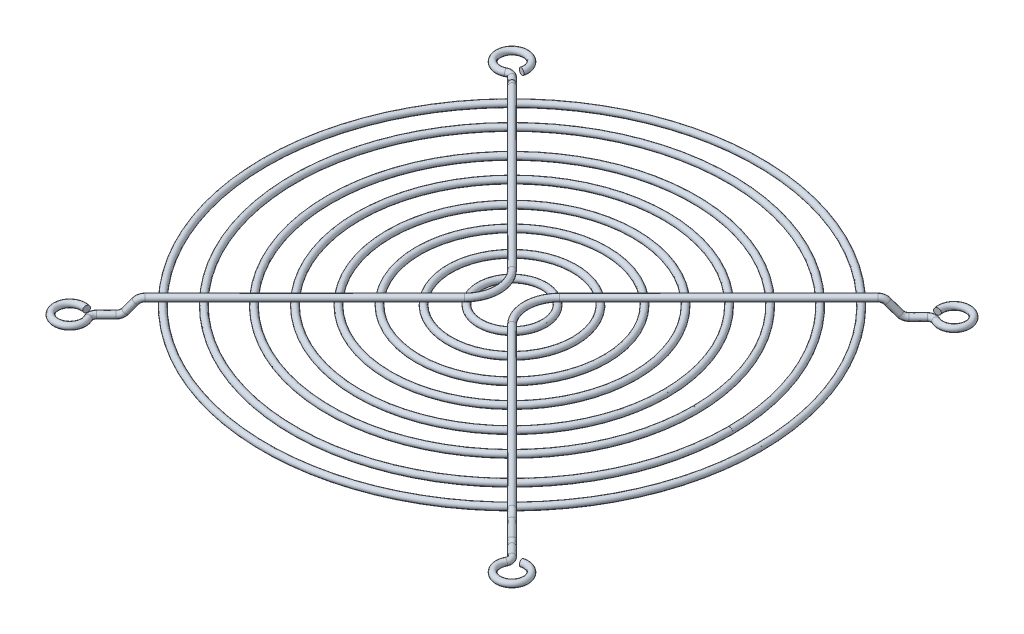
from build123d import *

# Parameters (mm, degrees)
BALAYAGE2_OUTLINE_R = 0.75
BALAYAGE2_ANGLE     = 359.984281
ESQUISSE4_R         = 0.75
ESQUISSE5_R         = 0.75
ESQUISSE7_R         = 0.75
ESQUISSE8_R         = 0.75
ESQUISSE11_R        = 0.75
ESQUISSE13_R        = 0.75
ESQUISSE19_R        = 0.75
ESQUISSE15_R        = 0.75
ESQUISSE20_R        = 0.75
ESQUISSE21_R        = 0.75


# Read off the part's stored shape, not the designer's step: Balayage2
with BuildPart() as part:
    # Balayage2 outline → Balayage2 (revolve)
    with BuildSketch(Plane.XY):
        with Locations((58.65, 0)):
            Circle(BALAYAGE2_OUTLINE_R)
        with Locations((51.75, 0)):
            Circle(BALAYAGE2_OUTLINE_R)
        with Locations((43.35, 0)):
            Circle(BALAYAGE2_OUTLINE_R)
        with Locations((36.45, 0)):
            Circle(BALAYAGE2_OUTLINE_R)
        with Locations((29.15, 0)):
            Circle(BALAYAGE2_OUTLINE_R)
        with Locations((22.25, 0)):
            Circle(BALAYAGE2_OUTLINE_R)
        with Locations((14.85, 0)):
            Circle(BALAYAGE2_OUTLINE_R)
        with Locations((7.65, 0)):
            Circle(BALAYAGE2_OUTLINE_R)
    revolve(axis=Axis((0, 0, 0), (0, 1, 0)), revolution_arc=BALAYAGE2_ANGLE)


with BuildPart() as body_2:
    # Balayage3: sweep along a path in Esquisse3
    with BuildLine(Plane(origin=(0, 1.5, 0), x_dir=(-1, 0, 0), z_dir=(0, 1, 0))) as balayage3_path:
        Line((-43, -43), (-5.656854249, -5.656854249))
        ThreePointArc((-5.656854249, -5.656854249), (-3.313708499, 0), (-5.656854249, 5.656854249))
        Line((-5.656854249, 5.656854249), (-43, 43))
    # Esquisse4 → Balayage3 (sweep)
    with BuildSketch(Plane(origin=(43, 0, -43), x_dir=(-0.7071067811865488, 0, -0.7071067811865462), z_dir=(0.7071067811865462, 0, -0.7071067811865488))):
        with Locations((0, 1.5)):
            Circle(ESQUISSE4_R)
    sweep(path=balayage3_path.line)

    # Balayage14: sweep along a path in Esquisse9
    with BuildLine(Plane(origin=(0, 0, 0), x_dir=(0.7071067811865488, 0, -0.7071067811865462), z_dir=(0.7071067811865462, 0, 0.7071067811865488))) as balayage14_path:
        Line((60.811183182, 1.5), (61.450368603, 1.5))
        ThreePointArc((61.450368603, 1.5), (62.295605127, 1.312615574), (62.98245749, 0.785575219))
        Line((62.98245749, 0.785575219), (65.139908874, -1.785575219))
        ThreePointArc((65.139908874, -1.785575219), (65.826761237, -2.312615574), (66.671997761, -2.5))
        Line((66.671997761, -2.5), (67.311183182, -2.5))
    # Esquisse8 → Balayage14 (sweep)
    with BuildSketch(Plane(origin=(43, 0, -43), x_dir=(-0.7071067811865488, 0, -0.7071067811865462), z_dir=(0.7071067811865462, 0, -0.7071067811865488))):
        with Locations((0, 1.5)):
            Circle(ESQUISSE8_R)
    sweep(path=balayage14_path.line)

    # Balayage16: sweep along a path in Esquisse12
    with BuildLine(Plane(origin=(0, 0, 0), x_dir=(-0.7071067811865488, 0, -0.7071067811865462), z_dir=(0.7071067811865462, 0, -0.7071067811865488))) as balayage16_path:
        Line((-60.811183182, 1.5), (-61.450368603, 1.5))
        ThreePointArc((-61.450368603, 1.5), (-62.295605127, 1.312615574), (-62.98245749, 0.785575219))
        Line((-62.98245749, 0.785575219), (-65.139908874, -1.785575219))
        ThreePointArc((-65.139908874, -1.785575219), (-65.826761237, -2.312615574), (-66.671997761, -2.5))
        Line((-66.671997761, -2.5), (-67.311183182, -2.5))
    # Esquisse13 → Balayage16 (sweep)
    with BuildSketch(Plane(origin=(43, 0, 43), x_dir=(0.7071067811865457, 0, -0.7071067811865495), z_dir=(0.7071067811865495, 0, 0.7071067811865457))):
        with Locations((0, 1.5)):
            Circle(ESQUISSE13_R)
    sweep(path=balayage16_path.line)

    # Balayage18: sweep along a path in Esquisse16
    with BuildLine(Plane(origin=(0, -2.5, 0), x_dir=(-1, 0, 0), z_dir=(0, 1, 0))) as balayage18_path:
        Line((-47.596194078, 47.596194078), (-49.313112804, 49.313112804))
        ThreePointArc((-49.313112804, 49.313112804), (-49.733139278, 50.133841618), (-49.59378338, 51.045213089))
        ThreePointArc((-49.59378338, 51.045213089), (-54.554281611, 55.018417571), (-51.658838103, 49.360741065))
    # Esquisse19 → Balayage18 (sweep)
    with BuildSketch(Plane(origin=(47.596194078, 0, 47.596194078), x_dir=(0.7071067811865456, 0, -0.7071067811865495), z_dir=(0.7071067811865495, 0, 0.7071067811865456))):
        with Locations((0, -2.5)):
            Circle(ESQUISSE19_R)
    sweep(path=balayage18_path.line)

    # Balayage20: sweep along a path in Esquisse17
    with BuildLine(Plane(origin=(0, -2.5, 0), x_dir=(-1, 0, 0), z_dir=(0, 1, 0))) as balayage20_path:
        Line((-47.596194078, -47.596194078), (-49.313112804, -49.313112804))
        ThreePointArc((-49.313112804, -49.313112804), (-50.133841618, -49.733139278), (-51.045213089, -49.59378338))
        ThreePointArc((-51.045213089, -49.59378338), (-55.018417571, -54.554281611), (-49.360741065, -51.658838103))
    # Esquisse20 → Balayage20 (sweep)
    with BuildSketch(Plane(origin=(47.596194078, 0, -47.596194078), x_dir=(-0.7071067811865488, 0, -0.7071067811865462), z_dir=(0.7071067811865462, 0, -0.7071067811865488))):
        with Locations((0, -2.5)):
            Circle(ESQUISSE20_R)
    sweep(path=balayage20_path.line)


with BuildPart() as body_3:
    # Balayage6: sweep along a path in Esquisse3<5>
    with BuildLine(Plane(origin=(0, 1.5, 0), x_dir=(-1, 0, 0), z_dir=(0, 1, 0))) as balayage6_path:
        Line((43, 43), (5.656854249, 5.656854249))
        ThreePointArc((5.656854249, 5.656854249), (3.313708499, 0), (5.656854249, -5.656854249))
        Line((5.656854249, -5.656854249), (43, -43))
    # Esquisse5 → Balayage6 (sweep)
    with BuildSketch(Plane(origin=(-43, 0, -43), x_dir=(0.7071067811865488, 0, -0.7071067811865462), z_dir=(0.7071067811865462, 0, 0.7071067811865488))):
        with Locations((0, 1.5)):
            Circle(ESQUISSE5_R)
    sweep(path=balayage6_path.line)

    # Balayage8: sweep along a path in Esquisse6
    with BuildLine(Plane(origin=(0, 0, 0), x_dir=(0.7071067811865488, 0, -0.7071067811865462), z_dir=(0.7071067811865462, 0, 0.7071067811865488))) as balayage8_path:
        Line((-60.811183182, 1.5), (-61.660143511, 1.5))
        ThreePointArc((-61.660143511, 1.5), (-62.505380035, 1.312615574), (-63.192232397, 0.785575219))
        Line((-63.192232397, 0.785575219), (-64.930133967, -1.285575219))
        ThreePointArc((-64.930133967, -1.285575219), (-65.616986329, -1.812615574), (-66.462222853, -2))
        Line((-66.462222853, -2), (-67.311183182, -2))
    # Esquisse7 → Balayage8 (sweep)
    with BuildSketch(Plane(origin=(-43, 0, 43), x_dir=(0.7071067811865449, 0, 0.7071067811865502), z_dir=(-0.7071067811865502, 0, 0.7071067811865449))):
        with Locations((0, 1.5)):
            Circle(ESQUISSE7_R)
    sweep(path=balayage8_path.line)

    # Balayage15: sweep along a path in Esquisse10
    with BuildLine(Plane(origin=(0, 0, 0), x_dir=(-0.7071067811865488, 0, -0.7071067811865462), z_dir=(0.7071067811865462, 0, -0.7071067811865488))) as balayage15_path:
        Line((60.811183182, 1.5), (61.450368603, 1.5))
        ThreePointArc((61.450368603, 1.5), (62.295605127, 1.312615574), (62.98245749, 0.785575219))
        Line((62.98245749, 0.785575219), (65.139908874, -1.785575219))
        ThreePointArc((65.139908874, -1.785575219), (65.826761237, -2.312615574), (66.671997761, -2.5))
        Line((66.671997761, -2.5), (67.311183182, -2.5))
    # Esquisse11 → Balayage15 (sweep)
    with BuildSketch(Plane(origin=(-43, 0, -43), x_dir=(-0.7071067811865488, 0, 0.7071067811865462), z_dir=(-0.7071067811865462, 0, -0.7071067811865488))):
        with Locations((0, 1.5)):
            Circle(ESQUISSE11_R)
    sweep(path=balayage15_path.line)

    # Balayage19: sweep along a path in Esquisse14
    with BuildLine(Plane(origin=(0, -2.5, 0), x_dir=(-1, 0, 0), z_dir=(0, 1, 0))) as balayage19_path:
        Line((47.596194078, 47.596194078), (49.313112804, 49.313112804))
        ThreePointArc((49.313112804, 49.313112804), (49.733139278, 50.133841618), (49.59378338, 51.045213089))
        ThreePointArc((49.59378338, 51.045213089), (54.554281611, 55.018417571), (51.658838103, 49.360741065))
    # Esquisse15 → Balayage19 (sweep)
    with BuildSketch(Plane(origin=(-47.596194078, 0, 47.596194078), x_dir=(0.7071067811865449, 0, 0.7071067811865501), z_dir=(-0.7071067811865501, 0, 0.7071067811865449))):
        with Locations((0, -2)):
            Circle(ESQUISSE15_R)
    sweep(path=balayage19_path.line)

    # Balayage21: sweep along a path in Esquisse18
    with BuildLine(Plane(origin=(0, -2.5, 0), x_dir=(-1, 0, 0), z_dir=(0, 1, 0))) as balayage21_path:
        Line((47.596194078, -47.596194078), (49.313112804, -49.313112804))
        ThreePointArc((49.313112804, -49.313112804), (50.133841618, -49.733139278), (51.045213089, -49.59378338))
        ThreePointArc((51.045213089, -49.59378338), (55.018417571, -54.554281611), (49.360741065, -51.658838103))
    # Esquisse21 → Balayage21 (sweep)
    with BuildSketch(Plane(origin=(-47.596194078, 0, -47.596194078), x_dir=(-0.7071067811865488, 0, 0.7071067811865462), z_dir=(-0.7071067811865462, 0, -0.7071067811865488))):
        with Locations((0, -2.5)):
            Circle(ESQUISSE21_R)
    sweep(path=balayage21_path.line)


solid = Compound([part.part, body_2.part, body_3.part])
